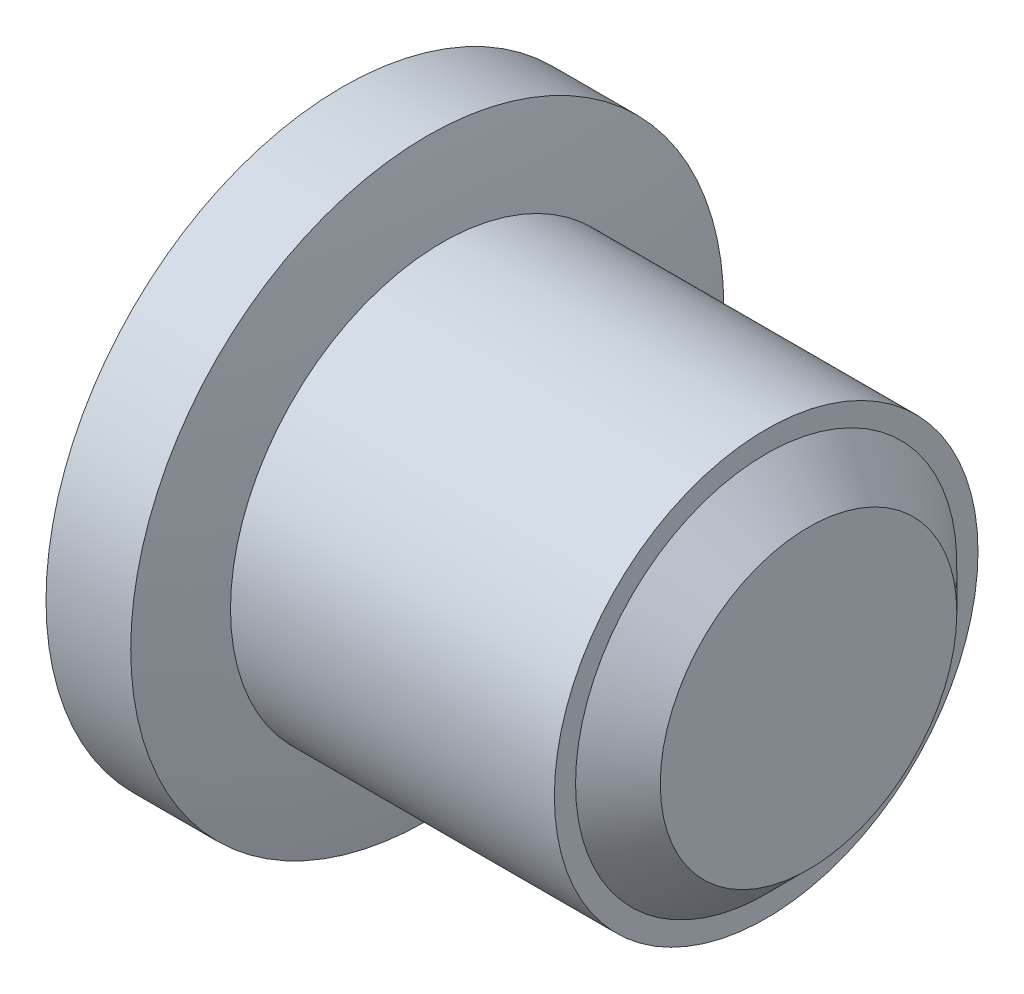
from build123d import *

# Parameters (mm, degrees)
SKETCH4_R           = 127
BOSS_EXTRUDE1_DEPTH = 254
SKETCH5_R           = 114.3
BOSS_EXTRUDE2_DEPTH = 25.4
CHAMFER1_SIZE       = 25.4


with BuildPart() as part:
    # Sketch3 → Revolve1 (revolve)
    with BuildSketch(Plane.XY, mode=Mode.PRIVATE) as revolve1_sk:
        with BuildLine():
            Line((-12.7, 177.8), (-63.5, 177.8))
            Line((-63.5, 177.8), (-63.5, 0))
            Line((-63.5, 0), (0, 0))
            ThreePointArc((0, 0), (0.183912717, 89.366708051), (-12.7, 177.8))
        make_face()
    revolve(revolve1_sk.sketch.rotate(Axis((-63.5, 0, 0), (1, 0, 0)), 90), axis=Axis((-63.5, 0, 0), (1, 0, 0)))

    # Sketch4 → Boss-Extrude1 (add)
    with BuildSketch(Plane.ZY.offset(63.5)):
        Circle(SKETCH4_R)
    extrude(amount=-BOSS_EXTRUDE1_DEPTH)

    # Sketch5 → Boss-Extrude2 (add)
    with BuildSketch(Plane(origin=(190.5, 0, 0), x_dir=(0, 0, -1), z_dir=(1, 0, 0))):
        Circle(SKETCH5_R)
    extrude(amount=BOSS_EXTRUDE2_DEPTH)

    # Chamfer1
    chamfer1_edges = [part.edges().sort_by_distance(p)[0] for p in [
        (215.9, 0, 114.3),
    ]]
    chamfer(chamfer1_edges, length=CHAMFER1_SIZE - 0.0001)  # a hair under: the kernel refuses the full size


solid = part.part
